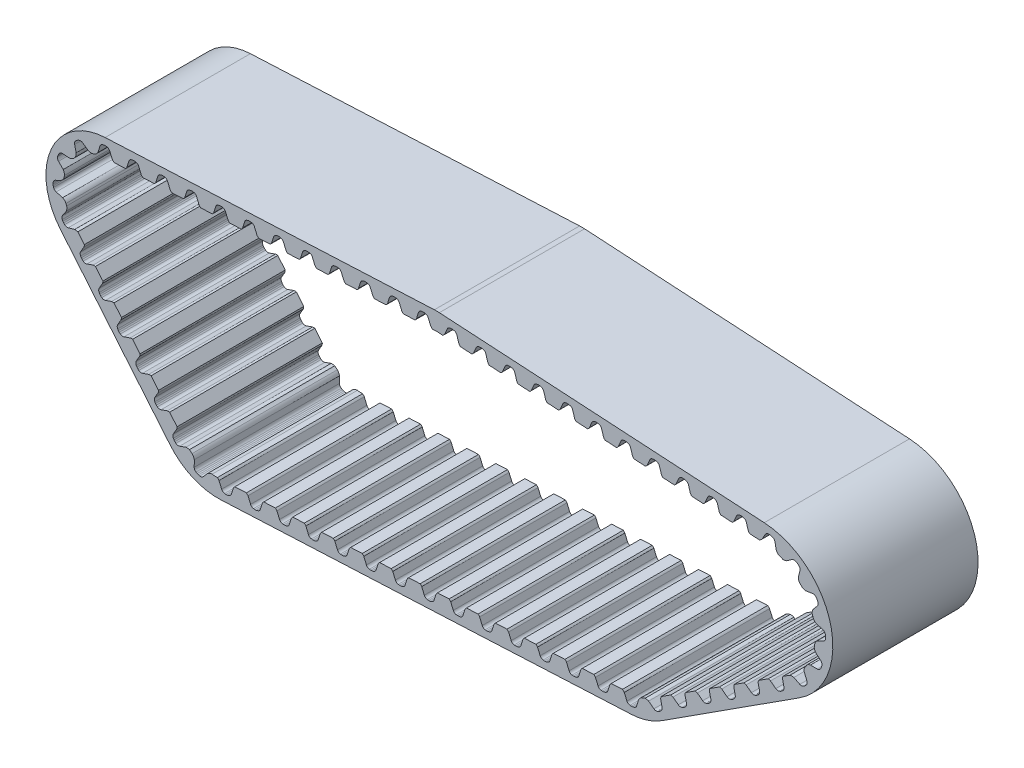
from build123d import *

# Parameters (mm, degrees)
EXTRUDE_THIN1_DEPTH = 23.5
CUT_EXTRUDE1_DEPTH  = 243.801978985
CRVPATTERN1_START   = -23.5
CRVPATTERN1_DEPTH   = 47


# Read off the part's stored shape, not the designer's step: CrvPattern1
with BuildPart() as part:
    # Sketch2 → Extrude-Thin1 (new, symmetric)
    with BuildSketch(Plane.XY):
        with BuildLine():
            Line((-103.735276554, 29.845488123), (1.408754191, 23.557916114))
            ThreePointArc((1.408754191, 23.557916114), (22.83034879, 5.977890442), (12.773230166, -19.844510352))
            Line((12.773230166, -19.844510352), (-31.718990744, -48.482625791))
            ThreePointArc((-31.718990744, -48.482625791), (-36.462798866, -50.721969822), (-41.624486842, -51.657573597))
            Line((-41.624486842, -51.657573597), (-90.638722177, -54.034014243))
            ThreePointArc((-90.638722177, -54.034014243), (-90.650882821, -54.034598934), (-90.663043932, -54.035173821))
            Line((-90.663043932, -54.035173821), (-174.494542463, -57.964139785))
            ThreePointArc((-174.494542463, -57.964139785), (-183.538750642, -56.28041853), (-190.885487118, -50.743444447))
            Line((-190.885487118, -50.743444447), (-226.394102859, -8.074490776))
            ThreePointArc((-226.394102859, -8.074490776), (-229.338468092, 12.885826392), (-211.885499661, 24.860719934))
            Line((-211.885499661, 24.860719934), (-105.343815721, 29.855846089))
            ThreePointArc((-105.343815721, 29.855846089), (-104.539408113, 29.872101623), (-103.735276554, 29.845488123))
        make_face()
        with BuildLine():
            Line((-104.075526506, 24.155652452), (1.068504238, 17.868080442))
            ThreePointArc((1.068504238, 17.868080442), (17.316239124, 4.53407792), (9.688170338, -15.051556581))
            Line((9.688170338, -15.051556581), (-34.804050573, -43.68967202))
            ThreePointArc((-34.804050573, -43.68967202), (-38.202599675, -45.293978191), (-41.900525389, -45.964261493))
            Line((-41.900525389, -45.964261493), (-90.914760724, -48.340702138))
            ThreePointArc((-90.914760724, -48.340702138), (-90.922329578, -48.341066054), (-90.929898724, -48.341423869))
            Line((-90.929898724, -48.341423869), (-174.761393835, -52.270389672))
            ThreePointArc((-174.761393835, -52.270389672), (-181.24082656, -51.064141609), (-186.504160155, -47.097354207))
            Line((-186.504160155, -47.097354207), (-222.012775896, -4.428400535))
            ThreePointArc((-222.012775896, -4.428400535), (-224.122171884, 10.587946093), (-211.618552709, 19.166974302))
            Line((-211.618552709, 19.166974302), (-105.07686877, 24.162100457))
            ThreePointArc((-105.07686877, 24.162100457), (-104.576111715, 24.172219796), (-104.075526506, 24.155652452))
        make_face(mode=Mode.SUBTRACT)
    extrude(amount=EXTRUDE_THIN1_DEPTH, both=True)

    # Sketch3 → Cut-Extrude1 (cut, symmetric)
    with BuildSketch(Plane.XY.offset(23.5)):
        with BuildLine():
            Line((18.586278327, -0.942730575), (20.554296532, -0.045322476))
            ThreePointArc((20.554296532, -0.045322476), (21.033515065, 0.349894471), (21.250922015, 0.931771653))
            Line((21.250922015, 0.931771653), (21.292969131, 1.369471611))
            Line((21.292969131, 1.369471611), (21.260450174, 1.805338008))
            Line((21.260450174, 1.805338008), (21.15391858, 2.231952861))
            ThreePointArc((21.15391858, 2.231952861), (20.852574204, 2.775127238), (20.32001513, 3.094857859))
            Line((20.32001513, 3.094857859), (18.240619062, 3.690297985))
            ThreePointArc((18.240619062, 3.690297985), (17.554412276, 4.223260232), (17.07945311, 4.950819372))
            ThreePointArc((17.07945311, 4.950819372), (15.419270028, 1.143906324), (17.62070002, -2.377812123))
            ThreePointArc((17.62070002, -2.377812123), (17.982060954, -1.578569752), (18.586278327, -0.942730575))
        make_face()
    extrude(amount=CUT_EXTRUDE1_DEPTH, both=True, mode=Mode.SUBTRACT)

    # CrvPattern1 outline → CrvPattern1 (cut)
    with BuildSketch(Plane.XY.offset(CRVPATTERN1_START)):
        with BuildLine():
            ThreePointArc((7.435006497, -20.499147469), (7.768448175, -19.975063998), (7.795175402, -19.354473559))
            Line((7.795175402, -19.354473559), (7.325772211, -17.243052806))
            ThreePointArc((7.325772211, -17.243052806), (7.351010391, -16.870815283), (7.428698337, -16.505901153))
            Line((7.428698337, -16.505901153), (2.704253067, -19.54686441))
            ThreePointArc((2.704253067, -19.54686441), (3.069519668, -19.627123594), (3.419698387, -19.758409887))
            Line((3.419698387, -19.758409887), (5.147711426, -21.059335668))
            ThreePointArc((5.147711426, -21.059335668), (5.72375147, -21.29176782), (6.338832857, -21.205039946))
            Line((6.338832857, -21.205039946), (6.743514797, -21.033046514))
            Line((6.743514797, -21.033046514), (7.110990693, -20.796406568))
            Line((7.110990693, -20.796406568), (7.435006497, -20.499147469))
        make_face()
        with BuildLine():
            ThreePointArc((-111.146172562, 24.442305878), (-111.354600443, 24.13286193), (-111.604741843, 23.856046072))
            Line((-111.604741843, 23.856046072), (-105.99238026, 24.119177394))
            ThreePointArc((-105.99238026, 24.119177394), (-106.268212238, 24.371720352), (-106.505410685, 24.660853752))
            Line((-106.505410685, 24.660853752), (-107.348542431, 26.652728701))
            ThreePointArc((-107.348542431, 26.652728701), (-107.730476539, 27.14259927), (-108.306176463, 27.375872573))
            Line((-108.306176463, 27.375872573), (-108.742559569, 27.429900326))
            Line((-108.742559569, 27.429900326), (-109.179153501, 27.409339763))
            Line((-109.179153501, 27.409339763), (-109.608527896, 27.314540804))
            ThreePointArc((-109.608527896, 27.314540804), (-110.159757434, 27.028196896), (-110.493964263, 26.504601029))
            Line((-110.493964263, 26.504601029), (-111.146172562, 24.442305878))
        make_face()
        with BuildLine():
            ThreePointArc((-120.516818461, 24.002970243), (-120.725246343, 23.693526294), (-120.975387743, 23.416710437))
            Line((-120.975387743, 23.416710437), (-115.36302616, 23.679841759))
            ThreePointArc((-115.36302616, 23.679841759), (-115.638858138, 23.932384717), (-115.876056585, 24.221518117))
            Line((-115.876056585, 24.221518117), (-116.71918833, 26.213393066))
            ThreePointArc((-116.71918833, 26.213393066), (-117.101122439, 26.703263634), (-117.676822363, 26.936536937))
            Line((-117.676822363, 26.936536937), (-118.113205469, 26.990564691))
            Line((-118.113205469, 26.990564691), (-118.549799401, 26.970004128))
            Line((-118.549799401, 26.970004128), (-118.979173795, 26.875205168))
            ThreePointArc((-118.979173795, 26.875205168), (-119.530403334, 26.588861261), (-119.864610163, 26.065265393))
            Line((-119.864610163, 26.065265393), (-120.516818461, 24.002970243))
        make_face()
        with BuildLine():
            ThreePointArc((-129.887464361, 23.563634607), (-130.095892242, 23.254190658), (-130.346033643, 22.977374801))
            Line((-130.346033643, 22.977374801), (-124.733672059, 23.240506123))
            ThreePointArc((-124.733672059, 23.240506123), (-125.009504038, 23.493049081), (-125.246702485, 23.782182481))
            Line((-125.246702485, 23.782182481), (-126.08983423, 25.77405743))
            ThreePointArc((-126.08983423, 25.77405743), (-126.471768338, 26.263927999), (-127.047468263, 26.497201302))
            Line((-127.047468263, 26.497201302), (-127.483851369, 26.551229055))
            Line((-127.483851369, 26.551229055), (-127.920445301, 26.530668492))
            Line((-127.920445301, 26.530668492), (-128.349819695, 26.435869533))
            ThreePointArc((-128.349819695, 26.435869533), (-128.901049233, 26.149525625), (-129.235256063, 25.625929758))
            Line((-129.235256063, 25.625929758), (-129.887464361, 23.563634607))
        make_face()
        with BuildLine():
            ThreePointArc((-139.258110261, 23.124298972), (-139.466538142, 22.814855023), (-139.716679543, 22.538039166))
            Line((-139.716679543, 22.538039166), (-134.104317959, 22.801170488))
            ThreePointArc((-134.104317959, 22.801170488), (-134.380149938, 23.053713446), (-134.617348385, 23.342846846))
            Line((-134.617348385, 23.342846846), (-135.46048013, 25.334721795))
            ThreePointArc((-135.46048013, 25.334721795), (-135.842414238, 25.824592363), (-136.418114163, 26.057865666))
            Line((-136.418114163, 26.057865666), (-136.854497269, 26.111893419))
            Line((-136.854497269, 26.111893419), (-137.291091201, 26.091332857))
            Line((-137.291091201, 26.091332857), (-137.720465595, 25.996533897))
            ThreePointArc((-137.720465595, 25.996533897), (-138.271695133, 25.71018999), (-138.605901963, 25.186594122))
            Line((-138.605901963, 25.186594122), (-139.258110261, 23.124298972))
        make_face()
        with BuildLine():
            ThreePointArc((-148.628756161, 22.684963336), (-148.837184042, 22.375519387), (-149.087325443, 22.09870353))
            Line((-149.087325443, 22.09870353), (-143.474963859, 22.361834852))
            ThreePointArc((-143.474963859, 22.361834852), (-143.750795837, 22.61437781), (-143.987994284, 22.90351121))
            Line((-143.987994284, 22.90351121), (-144.83112603, 24.895386159))
            ThreePointArc((-144.83112603, 24.895386159), (-145.213060138, 25.385256728), (-145.788760063, 25.618530031))
            Line((-145.788760063, 25.618530031), (-146.225143169, 25.672557784))
            Line((-146.225143169, 25.672557784), (-146.661737101, 25.651997221))
            Line((-146.661737101, 25.651997221), (-147.091111495, 25.557198262))
            ThreePointArc((-147.091111495, 25.557198262), (-147.642341033, 25.270854354), (-147.976547863, 24.747258487))
            Line((-147.976547863, 24.747258487), (-148.628756161, 22.684963336))
        make_face()
        with BuildLine():
            ThreePointArc((-157.999402061, 22.245627701), (-158.207829942, 21.936183752), (-158.457971342, 21.659367895))
            Line((-158.457971342, 21.659367895), (-152.845609759, 21.922499217))
            ThreePointArc((-152.845609759, 21.922499217), (-153.121441737, 22.175042175), (-153.358640184, 22.464175575))
            Line((-153.358640184, 22.464175575), (-154.20177193, 24.456050524))
            ThreePointArc((-154.20177193, 24.456050524), (-154.583706038, 24.945921092), (-155.159405963, 25.179194395))
            Line((-155.159405963, 25.179194395), (-155.595789068, 25.233222148))
            Line((-155.595789068, 25.233222148), (-156.032383001, 25.212661586))
            Line((-156.032383001, 25.212661586), (-156.461757395, 25.117862626))
            ThreePointArc((-156.461757395, 25.117862626), (-157.012986933, 24.831518719), (-157.347193762, 24.307922851))
            Line((-157.347193762, 24.307922851), (-157.999402061, 22.245627701))
        make_face()
        with BuildLine():
            ThreePointArc((-167.37004796, 21.806292065), (-167.578475842, 21.496848116), (-167.828617242, 21.220032259))
            Line((-167.828617242, 21.220032259), (-162.216255659, 21.483163581))
            ThreePointArc((-162.216255659, 21.483163581), (-162.492087637, 21.735706539), (-162.729286084, 22.024839939))
            Line((-162.729286084, 22.024839939), (-163.57241783, 24.016714888))
            ThreePointArc((-163.57241783, 24.016714888), (-163.954351938, 24.506585457), (-164.530051862, 24.73985876))
            Line((-164.530051862, 24.73985876), (-164.966434968, 24.793886513))
            Line((-164.966434968, 24.793886513), (-165.4030289, 24.77332595))
            Line((-165.4030289, 24.77332595), (-165.832403295, 24.67852699))
            ThreePointArc((-165.832403295, 24.67852699), (-166.383632833, 24.392183083), (-166.717839662, 23.868587216))
            Line((-166.717839662, 23.868587216), (-167.37004796, 21.806292065))
        make_face()
        with BuildLine():
            ThreePointArc((-176.74069386, 21.36695643), (-176.949121742, 21.057512481), (-177.199263142, 20.780696624))
            Line((-177.199263142, 20.780696624), (-171.586901558, 21.043827945))
            ThreePointArc((-171.586901558, 21.043827945), (-171.862733536, 21.296370903), (-172.099931984, 21.585504303))
            Line((-172.099931984, 21.585504303), (-172.943063729, 23.577379252))
            ThreePointArc((-172.943063729, 23.577379252), (-173.324997837, 24.067249821), (-173.900697762, 24.300523124))
            Line((-173.900697762, 24.300523124), (-174.337080868, 24.354550877))
            Line((-174.337080868, 24.354550877), (-174.7736748, 24.333990315))
            Line((-174.7736748, 24.333990315), (-175.203049194, 24.239191355))
            ThreePointArc((-175.203049194, 24.239191355), (-175.754278732, 23.952847448), (-176.088485562, 23.42925158))
            Line((-176.088485562, 23.42925158), (-176.74069386, 21.36695643))
        make_face()
        with BuildLine():
            ThreePointArc((-186.11133976, 20.927620794), (-186.319767641, 20.618176845), (-186.569909042, 20.341360988))
            Line((-186.569909042, 20.341360988), (-180.957547458, 20.60449231))
            ThreePointArc((-180.957547458, 20.60449231), (-181.233379437, 20.857035268), (-181.470577884, 21.146168668))
            Line((-181.470577884, 21.146168668), (-182.313709629, 23.138043617))
            ThreePointArc((-182.313709629, 23.138043617), (-182.695643737, 23.627914186), (-183.271343662, 23.861187489))
            Line((-183.271343662, 23.861187489), (-183.707726768, 23.915215242))
            Line((-183.707726768, 23.915215242), (-184.1443207, 23.894654679))
            Line((-184.1443207, 23.894654679), (-184.573695094, 23.799855719))
            ThreePointArc((-184.573695094, 23.799855719), (-185.124924632, 23.513511812), (-185.459131462, 22.989915945))
            Line((-185.459131462, 22.989915945), (-186.11133976, 20.927620794))
        make_face()
        with BuildLine():
            ThreePointArc((-195.48198566, 20.488285159), (-195.690413541, 20.17884121), (-195.940554942, 19.902025352))
            Line((-195.940554942, 19.902025352), (-190.328193358, 20.165156674))
            ThreePointArc((-190.328193358, 20.165156674), (-190.604025336, 20.417699633), (-190.841223784, 20.706833032))
            Line((-190.841223784, 20.706833032), (-191.684355529, 22.698707981))
            ThreePointArc((-191.684355529, 22.698707981), (-192.066289637, 23.18857855), (-192.641989562, 23.421851853))
            Line((-192.641989562, 23.421851853), (-193.078372668, 23.475879606))
            Line((-193.078372668, 23.475879606), (-193.5149666, 23.455319044))
            Line((-193.5149666, 23.455319044), (-193.944340994, 23.360520084))
            ThreePointArc((-193.944340994, 23.360520084), (-194.495570532, 23.074176176), (-194.829777362, 22.550580309))
            Line((-194.829777362, 22.550580309), (-195.48198566, 20.488285159))
        make_face()
        with BuildLine():
            ThreePointArc((-204.85263156, 20.048949523), (-205.061059441, 19.739505574), (-205.311200842, 19.462689717))
            Line((-205.311200842, 19.462689717), (-199.698839258, 19.725821039))
            ThreePointArc((-199.698839258, 19.725821039), (-199.974671236, 19.978363997), (-200.211869683, 20.267497397))
            Line((-200.211869683, 20.267497397), (-201.055001429, 22.259372346))
            ThreePointArc((-201.055001429, 22.259372346), (-201.436935537, 22.749242915), (-202.012635462, 22.982516218))
            Line((-202.012635462, 22.982516218), (-202.449018567, 23.036543971))
            Line((-202.449018567, 23.036543971), (-202.8856125, 23.015983408))
            Line((-202.8856125, 23.015983408), (-203.314986894, 22.921184448))
            ThreePointArc((-203.314986894, 22.921184448), (-203.866216432, 22.634840541), (-204.200423262, 22.111244674))
            Line((-204.200423262, 22.111244674), (-204.85263156, 20.048949523))
        make_face()
        with BuildLine():
            ThreePointArc((-214.183330625, 19.576262438), (-214.654011675, 18.96327482), (-215.282627075, 18.513678167))
            ThreePointArc((-215.282627075, 18.513678167), (-213.471785325, 18.959202861), (-211.618552709, 19.166974302))
            Line((-211.618552709, 19.166974302), (-208.976405214, 19.290849386))
            ThreePointArc((-208.976405214, 19.290849386), (-209.283343953, 19.554359297), (-209.54621141, 19.861848423))
            Line((-209.54621141, 19.861848423), (-210.418038539, 21.841331792))
            ThreePointArc((-210.418038539, 21.841331792), (-210.807011601, 22.325632106), (-211.386022311, 22.55056195))
            Line((-211.386022311, 22.55056195), (-211.823140577, 22.598278146))
            Line((-211.823140577, 22.598278146), (-212.259391814, 22.571410767))
            Line((-212.259391814, 22.571410767), (-212.687351492, 22.470417067))
            ThreePointArc((-212.687351492, 22.470417067), (-213.234385687, 22.176137563), (-213.560991444, 21.647766939))
            Line((-213.560991444, 21.647766939), (-214.183330625, 19.576262438))
        make_face()
        with BuildLine():
            ThreePointArc((-221.250961333, 15.878240308), (-221.34487559, 15.111119337), (-221.657839197, 14.404473562))
            ThreePointArc((-221.657839197, 14.404473562), (-219.011176926, 16.711028854), (-215.885029086, 18.308595182))
            ThreePointArc((-215.885029086, 18.308595182), (-216.656371241, 18.281929146), (-217.402205121, 18.48045275))
            Line((-217.402205121, 18.48045275), (-219.158922185, 19.742348986))
            ThreePointArc((-219.158922185, 19.742348986), (-219.740023628, 19.961820965), (-220.35300823, 19.861338552))
            Line((-220.35300823, 19.861338552), (-220.753736427, 19.680324394))
            Line((-220.753736427, 19.680324394), (-221.115819993, 19.435513263))
            Line((-221.115819993, 19.435513263), (-221.433096651, 19.131071585))
            ThreePointArc((-221.433096651, 19.131071585), (-221.754716514, 18.599651317), (-221.767537352, 17.978617934))
            Line((-221.767537352, 17.978617934), (-221.250961333, 15.878240308))
        make_face()
        with BuildLine():
            ThreePointArc((-225.459126195, 9.101949288), (-225.150218571, 8.393521062), (-225.06070337, 7.625874334))
            ThreePointArc((-225.06070337, 7.625874334), (-223.953200681, 10.957308902), (-222.072469492, 13.921742859))
            ThreePointArc((-222.072469492, 13.921742859), (-222.723263333, 13.506836635), (-223.466512118, 13.298843748))
            Line((-223.466512118, 13.298843748), (-225.620744568, 13.493058848))
            ThreePointArc((-225.620744568, 13.493058848), (-226.232756597, 13.386813314), (-226.709651794, 12.988795968))
            Line((-226.709651794, 12.988795968), (-226.962813953, 12.629271095))
            Line((-226.962813953, 12.629271095), (-227.150275244, 12.234435353))
            Line((-227.150275244, 12.234435353), (-227.268845277, 11.811008429))
            ThreePointArc((-227.268845277, 11.811008429), (-227.275822248, 11.189881905), (-226.971301219, 10.648482071))
            Line((-226.971301219, 10.648482071), (-225.459126195, 9.101949288))
        make_face()
        with BuildLine():
            ThreePointArc((-225.640333591, 1.127368711), (-225.014305828, 0.674175914), (-224.547146457, 0.058500194))
            ThreePointArc((-224.547146457, 0.058500194), (-225.286063201, 3.490557964), (-225.172529052, 6.999422237))
            ThreePointArc((-225.172529052, 6.999422237), (-225.522221681, 6.311385273), (-226.056682252, 5.754580373))
            Line((-226.056682252, 5.754580373), (-228.010770914, 4.827232298))
            ThreePointArc((-228.010770914, 4.827232298), (-228.483900059, 4.424745466), (-228.692398501, 3.839617073))
            Line((-228.692398501, 3.839617073), (-228.727758613, 3.401326216))
            Line((-228.727758613, 3.401326216), (-228.688589334, 2.966007061))
            Line((-228.688589334, 2.966007061), (-228.575557282, 2.54106828))
            ThreePointArc((-228.575557282, 2.54106828), (-228.265955705, 2.002557648), (-227.728577558, 1.690994548))
            Line((-227.728577558, 1.690994548), (-225.640333591, 1.127368711))
        make_face()
        with BuildLine():
            ThreePointArc((-221.744310273, -5.833074795), (-221.224772856, -5.856538472), (-220.72002507, -5.981835497))
            Line((-220.72002507, -5.981835497), (-222.012775896, -4.428400535))
            ThreePointArc((-222.012775896, -4.428400535), (-223.322761447, -2.574550545), (-224.325143184, -0.537873649))
            ThreePointArc((-224.325143184, -0.537873649), (-224.276717678, -1.308155915), (-224.45411204, -2.059295741))
            Line((-224.45411204, -2.059295741), (-225.665924606, -3.850928309))
            ThreePointArc((-225.665924606, -3.850928309), (-225.868908348, -4.437992562), (-225.7511653, -5.04789699))
            Line((-225.7511653, -5.04789699), (-225.558913238, -5.44335667))
            Line((-225.558913238, -5.44335667), (-225.303980311, -5.798386529))
            Line((-225.303980311, -5.798386529), (-224.990705206, -6.106944338))
            ThreePointArc((-224.990705206, -6.106944338), (-224.450419351, -6.413437457), (-223.829271516, -6.408725357))
            Line((-223.829271516, -6.408725357), (-221.744310273, -5.833074795))
        make_face()
        with BuildLine():
            ThreePointArc((-215.762622469, -12.820833045), (-215.390083379, -12.800526256), (-215.018422142, -12.83317076))
            Line((-215.018422142, -12.83317076), (-218.612396675, -8.514468676))
            ThreePointArc((-218.612396675, -8.514468676), (-218.647550308, -8.886793061), (-218.735189278, -9.250359612))
            Line((-218.735189278, -9.250359612), (-219.815864037, -11.124013533))
            ThreePointArc((-219.815864037, -11.124013533), (-219.976374126, -11.724082986), (-219.815345214, -12.324013421))
            Line((-219.815345214, -12.324013421), (-219.595323132, -12.704722623))
            Line((-219.595323132, -12.704722623), (-219.315669776, -13.040625882))
            Line((-219.315669776, -13.040625882), (-218.98114455, -13.32600648))
            ThreePointArc((-218.98114455, -13.32600648), (-218.420336573, -13.593104308), (-217.801113704, -13.544013824))
            Line((-217.801113704, -13.544013824), (-215.762622469, -12.820833045))
        make_face()
        with BuildLine():
            ThreePointArc((-209.761964419, -20.031528112), (-209.389425329, -20.011221323), (-209.017764092, -20.043865827))
            Line((-209.017764092, -20.043865827), (-212.611738624, -15.725163742))
            ThreePointArc((-212.611738624, -15.725163742), (-212.646892258, -16.097488128), (-212.734531227, -16.461054679))
            Line((-212.734531227, -16.461054679), (-213.815205987, -18.3347086))
            ThreePointArc((-213.815205987, -18.3347086), (-213.975716076, -18.934778053), (-213.814687164, -19.534708488))
            Line((-213.814687164, -19.534708488), (-213.594665082, -19.91541769))
            Line((-213.594665082, -19.91541769), (-213.315011726, -20.251320948))
            Line((-213.315011726, -20.251320948), (-212.9804865, -20.536701547))
            ThreePointArc((-212.9804865, -20.536701547), (-212.419678523, -20.803799375), (-211.800455654, -20.754708891))
            Line((-211.800455654, -20.754708891), (-209.761964419, -20.031528112))
        make_face()
        with BuildLine():
            ThreePointArc((-203.761306368, -27.242223179), (-203.388767278, -27.22191639), (-203.017106041, -27.254560893))
            Line((-203.017106041, -27.254560893), (-206.611080574, -22.935858809))
            ThreePointArc((-206.611080574, -22.935858809), (-206.646234207, -23.308183195), (-206.733873177, -23.671749746))
            Line((-206.733873177, -23.671749746), (-207.814547937, -25.545403667))
            ThreePointArc((-207.814547937, -25.545403667), (-207.975058026, -26.14547312), (-207.814029114, -26.745403554))
            Line((-207.814029114, -26.745403554), (-207.594007031, -27.126112756))
            Line((-207.594007031, -27.126112756), (-207.314353676, -27.462016015))
            Line((-207.314353676, -27.462016015), (-206.979828449, -27.747396614))
            ThreePointArc((-206.979828449, -27.747396614), (-206.419020472, -28.014494442), (-205.799797603, -27.965403957))
            Line((-205.799797603, -27.965403957), (-203.761306368, -27.242223179))
        make_face()
        with BuildLine():
            ThreePointArc((-197.760648318, -34.452918245), (-197.388109228, -34.432611456), (-197.016447991, -34.46525596))
            Line((-197.016447991, -34.46525596), (-200.610422523, -30.146553875))
            ThreePointArc((-200.610422523, -30.146553875), (-200.645576157, -30.518878261), (-200.733215126, -30.882444812))
            Line((-200.733215126, -30.882444812), (-201.813889886, -32.756098733))
            ThreePointArc((-201.813889886, -32.756098733), (-201.974399975, -33.356168186), (-201.813371063, -33.956098621))
            Line((-201.813371063, -33.956098621), (-201.593348981, -34.336807823))
            Line((-201.593348981, -34.336807823), (-201.313695625, -34.672711081))
            Line((-201.313695625, -34.672711081), (-200.979170399, -34.95809168))
            ThreePointArc((-200.979170399, -34.95809168), (-200.418362422, -35.225189508), (-199.799139553, -35.176099024))
            Line((-199.799139553, -35.176099024), (-197.760648318, -34.452918245))
        make_face()
        with BuildLine():
            ThreePointArc((-191.759990268, -41.663613312), (-191.387451178, -41.643306523), (-191.01578994, -41.675951027))
            Line((-191.01578994, -41.675951027), (-194.609764473, -37.357248942))
            ThreePointArc((-194.609764473, -37.357248942), (-194.644918107, -37.729573328), (-194.732557076, -38.093139879))
            Line((-194.732557076, -38.093139879), (-195.813231836, -39.9667938))
            ThreePointArc((-195.813231836, -39.9667938), (-195.973741925, -40.566863253), (-195.812713013, -41.166793688))
            Line((-195.812713013, -41.166793688), (-195.592690931, -41.547502889))
            Line((-195.592690931, -41.547502889), (-195.313037575, -41.883406148))
            Line((-195.313037575, -41.883406148), (-194.978512349, -42.168786747))
            ThreePointArc((-194.978512349, -42.168786747), (-194.417704371, -42.435884575), (-193.798481502, -42.38679409))
            Line((-193.798481502, -42.38679409), (-191.759990268, -41.663613312))
        make_face()
        with BuildLine():
            ThreePointArc((-185.759332217, -48.874308378), (-185.17883892, -48.865702728), (-184.610616529, -48.984739866))
            ThreePointArc((-184.610616529, -48.984739866), (-185.601284952, -48.085086868), (-186.504160155, -47.097354207))
            Line((-186.504160155, -47.097354207), (-188.609106423, -44.567944008))
            ThreePointArc((-188.609106423, -44.567944008), (-188.644260056, -44.940268394), (-188.731899026, -45.303834945))
            Line((-188.731899026, -45.303834945), (-189.812573786, -47.177488866))
            ThreePointArc((-189.812573786, -47.177488866), (-189.973083875, -47.777558319), (-189.812054963, -48.377488754))
            Line((-189.812054963, -48.377488754), (-189.59203288, -48.758197956))
            Line((-189.59203288, -48.758197956), (-189.312379525, -49.094101215))
            Line((-189.312379525, -49.094101215), (-188.977854298, -49.379481813))
            ThreePointArc((-188.977854298, -49.379481813), (-188.417046321, -49.646579641), (-187.797823452, -49.597489157))
            Line((-187.797823452, -49.597489157), (-185.759332217, -48.874308378))
        make_face()
        with BuildLine():
            ThreePointArc((-178.696022447, -52.674984916), (-178.011732717, -52.315760701), (-177.252546969, -52.171083574))
            ThreePointArc((-177.252546969, -52.171083574), (-180.655216273, -51.306872895), (-183.747639874, -49.64496593))
            ThreePointArc((-183.747639874, -49.64496593), (-183.28685245, -50.26412241), (-183.025767138, -50.990424178))
            Line((-183.025767138, -50.990424178), (-183.064021111, -53.15305535))
            ThreePointArc((-183.064021111, -53.15305535), (-182.913888257, -53.755804853), (-182.482494639, -54.202734807))
            Line((-182.482494639, -54.202734807), (-182.105638274, -54.429292732))
            Line((-182.105638274, -54.429292732), (-181.69830424, -54.58777296))
            Line((-181.69830424, -54.58777296), (-181.267424927, -54.675478324))
            ThreePointArc((-181.267424927, -54.675478324), (-180.647414273, -54.637615066), (-180.129400925, -54.294819195))
            Line((-180.129400925, -54.294819195), (-178.696022447, -52.674984916))
        make_face()
        with BuildLine():
            ThreePointArc((-170.390352876, -52.630289953), (-170.181919801, -52.320849503), (-169.931773753, -52.044037845))
            Line((-169.931773753, -52.044037845), (-174.761393835, -52.270389672))
            ThreePointArc((-174.761393835, -52.270389672), (-175.166436868, -52.283664093), (-175.571693043, -52.285535222))
            ThreePointArc((-175.571693043, -52.285535222), (-175.280378757, -52.546966197), (-175.031118421, -52.848759923))
            Line((-175.031118421, -52.848759923), (-174.188020112, -54.840649025))
            ThreePointArc((-174.188020112, -54.840649025), (-173.806094228, -55.330526006), (-173.230398219, -55.563808973))
            Line((-173.230398219, -55.563808973), (-172.79401602, -55.617844051))
            Line((-172.79401602, -55.617844051), (-172.357421743, -55.597290817))
            Line((-172.357421743, -55.597290817), (-171.928045757, -55.502499066))
            ThreePointArc((-171.928045757, -55.502499066), (-171.376811413, -55.216164411), (-171.042595794, -54.692574155))
            Line((-171.042595794, -54.692574155), (-170.390352876, -52.630289953))
        make_face()
        with BuildLine():
            ThreePointArc((-161.019699603, -52.19111162), (-160.811266527, -51.88167117), (-160.56112048, -51.604859512))
            Line((-160.56112048, -51.604859512), (-166.17348648, -51.86789662))
            ThreePointArc((-166.17348648, -51.86789662), (-165.897658741, -52.120444209), (-165.660465147, -52.40958159))
            Line((-165.660465147, -52.40958159), (-164.817366839, -54.401470693))
            ThreePointArc((-164.817366839, -54.401470693), (-164.435440954, -54.891347673), (-163.859744945, -55.12463064))
            Line((-163.859744945, -55.12463064), (-163.423362747, -55.178665718))
            Line((-163.423362747, -55.178665718), (-162.986768469, -55.158112485))
            Line((-162.986768469, -55.158112485), (-162.557392484, -55.063320733))
            ThreePointArc((-162.557392484, -55.063320733), (-162.006158139, -54.776986079), (-161.67194252, -54.253395822))
            Line((-161.67194252, -54.253395822), (-161.019699603, -52.19111162))
        make_face()
        with BuildLine():
            ThreePointArc((-151.649046329, -51.751933287), (-151.440613253, -51.442492837), (-151.190467206, -51.165681179))
            Line((-151.190467206, -51.165681179), (-156.802833206, -51.428718287))
            ThreePointArc((-156.802833206, -51.428718287), (-156.527005467, -51.681265876), (-156.289811874, -51.970403257))
            Line((-156.289811874, -51.970403257), (-155.446713565, -53.96229236))
            ThreePointArc((-155.446713565, -53.96229236), (-155.064787681, -54.45216934), (-154.489091672, -54.685452307))
            Line((-154.489091672, -54.685452307), (-154.052709473, -54.739487385))
            Line((-154.052709473, -54.739487385), (-153.616115196, -54.718934152))
            Line((-153.616115196, -54.718934152), (-153.18673921, -54.6241424))
            ThreePointArc((-153.18673921, -54.6241424), (-152.635504866, -54.337807746), (-152.301289247, -53.814217489))
            Line((-152.301289247, -53.814217489), (-151.649046329, -51.751933287))
        make_face()
        with BuildLine():
            ThreePointArc((-142.278393056, -51.312754954), (-142.06995998, -51.003314504), (-141.819813933, -50.726502846))
            Line((-141.819813933, -50.726502846), (-147.432179933, -50.989539954))
            ThreePointArc((-147.432179933, -50.989539954), (-147.156352194, -51.242087543), (-146.9191586, -51.531224924))
            Line((-146.9191586, -51.531224924), (-146.076060292, -53.523114027))
            ThreePointArc((-146.076060292, -53.523114027), (-145.694134407, -54.012991007), (-145.118438398, -54.246273974))
            Line((-145.118438398, -54.246273974), (-144.6820562, -54.300309052))
            Line((-144.6820562, -54.300309052), (-144.245461922, -54.279755819))
            Line((-144.245461922, -54.279755819), (-143.816085937, -54.184964067))
            ThreePointArc((-143.816085937, -54.184964067), (-143.264851592, -53.898629413), (-142.930635973, -53.375039156))
            Line((-142.930635973, -53.375039156), (-142.278393056, -51.312754954))
        make_face()
        with BuildLine():
            ThreePointArc((-132.907739782, -50.873576621), (-132.699306706, -50.564136171), (-132.449160659, -50.287324513))
            Line((-132.449160659, -50.287324513), (-138.061526659, -50.550361621))
            ThreePointArc((-138.061526659, -50.550361621), (-137.78569892, -50.80290921), (-137.548505327, -51.092046592))
            Line((-137.548505327, -51.092046592), (-136.705407018, -53.083935694))
            ThreePointArc((-136.705407018, -53.083935694), (-136.323481134, -53.573812674), (-135.747785125, -53.807095641))
            Line((-135.747785125, -53.807095641), (-135.311402926, -53.861130719))
            Line((-135.311402926, -53.861130719), (-134.874808649, -53.840577486))
            Line((-134.874808649, -53.840577486), (-134.445432663, -53.745785734))
            ThreePointArc((-134.445432663, -53.745785734), (-133.894198319, -53.45945108), (-133.5599827, -52.935860823))
            Line((-133.5599827, -52.935860823), (-132.907739782, -50.873576621))
        make_face()
        with BuildLine():
            ThreePointArc((-123.537086509, -50.434398288), (-123.328653433, -50.124957838), (-123.078507386, -49.84814618))
            Line((-123.078507386, -49.84814618), (-128.690873386, -50.111183289))
            ThreePointArc((-128.690873386, -50.111183289), (-128.415045647, -50.363730877), (-128.177852053, -50.652868259))
            Line((-128.177852053, -50.652868259), (-127.334753745, -52.644757361))
            ThreePointArc((-127.334753745, -52.644757361), (-126.95282786, -53.134634341), (-126.377131851, -53.367917308))
            Line((-126.377131851, -53.367917308), (-125.940749653, -53.421952386))
            Line((-125.940749653, -53.421952386), (-125.504155375, -53.401399153))
            Line((-125.504155375, -53.401399153), (-125.07477939, -53.306607401))
            ThreePointArc((-125.07477939, -53.306607401), (-124.523545045, -53.020272747), (-124.189329426, -52.49668249))
            Line((-124.189329426, -52.49668249), (-123.537086509, -50.434398288))
        make_face()
        with BuildLine():
            ThreePointArc((-114.166433235, -49.995219955), (-113.958000159, -49.685779505), (-113.707854112, -49.408967847))
            Line((-113.707854112, -49.408967847), (-119.320220112, -49.672004956))
            ThreePointArc((-119.320220112, -49.672004956), (-119.044392373, -49.924552544), (-118.80719878, -50.213689926))
            Line((-118.80719878, -50.213689926), (-117.964100471, -52.205579028))
            ThreePointArc((-117.964100471, -52.205579028), (-117.582174587, -52.695456008), (-117.006478578, -52.928738975))
            Line((-117.006478578, -52.928738975), (-116.570096379, -52.982774054))
            Line((-116.570096379, -52.982774054), (-116.133502102, -52.96222082))
            Line((-116.133502102, -52.96222082), (-115.704126116, -52.867429068))
            ThreePointArc((-115.704126116, -52.867429068), (-115.152891772, -52.581094414), (-114.818676153, -52.057504157))
            Line((-114.818676153, -52.057504157), (-114.166433235, -49.995219955))
        make_face()
        with BuildLine():
            ThreePointArc((-104.795779962, -49.556041622), (-104.587346886, -49.246601172), (-104.337200839, -48.969789514))
            Line((-104.337200839, -48.969789514), (-109.949566839, -49.232826623))
            ThreePointArc((-109.949566839, -49.232826623), (-109.6737391, -49.485374211), (-109.436545506, -49.774511593))
            Line((-109.436545506, -49.774511593), (-108.593447198, -51.766400695))
            ThreePointArc((-108.593447198, -51.766400695), (-108.211521313, -52.256277675), (-107.635825304, -52.489560642))
            Line((-107.635825304, -52.489560642), (-107.199443106, -52.543595721))
            Line((-107.199443106, -52.543595721), (-106.762848828, -52.523042487))
            Line((-106.762848828, -52.523042487), (-106.333472843, -52.428250735))
            ThreePointArc((-106.333472843, -52.428250735), (-105.782238498, -52.141916081), (-105.448022879, -51.618325824))
            Line((-105.448022879, -51.618325824), (-104.795779962, -49.556041622))
        make_face()
        with BuildLine():
            ThreePointArc((-95.425126688, -49.116863289), (-95.216693612, -48.807422839), (-94.966547565, -48.530611181))
            Line((-94.966547565, -48.530611181), (-100.578913565, -48.79364829))
            ThreePointArc((-100.578913565, -48.79364829), (-100.303085826, -49.046195878), (-100.065892233, -49.33533326))
            Line((-100.065892233, -49.33533326), (-99.222793924, -51.327222362))
            ThreePointArc((-99.222793924, -51.327222362), (-98.84086804, -51.817099342), (-98.265172031, -52.050382309))
            Line((-98.265172031, -52.050382309), (-97.828789832, -52.104417388))
            Line((-97.828789832, -52.104417388), (-97.392195555, -52.083864154))
            Line((-97.392195555, -52.083864154), (-96.962819569, -51.989072402))
            ThreePointArc((-96.962819569, -51.989072402), (-96.411585224, -51.702737748), (-96.077369605, -51.179147491))
            Line((-96.077369605, -51.179147491), (-95.425126688, -49.116863289))
        make_face()
        with BuildLine():
            ThreePointArc((-86.059094093, -48.670079721), (-85.851160607, -48.360303343), (-85.601461553, -48.083088406))
            Line((-85.601461553, -48.083088406), (-90.914760718, -48.340702138))
            ThreePointArc((-90.914760718, -48.340702138), (-90.922335962, -48.341066359), (-90.929911498, -48.341424467))
            Line((-90.929911498, -48.341424467), (-91.213958509, -48.354737017))
            ThreePointArc((-91.213958509, -48.354737017), (-90.937407866, -48.607023676), (-90.69950107, -48.896037817))
            Line((-90.69950107, -48.896037817), (-89.853189716, -50.88656389))
            ThreePointArc((-89.853189716, -50.88656389), (-89.470473856, -51.375823951), (-88.894402168, -51.608177663))
            Line((-88.894402168, -51.608177663), (-88.457933345, -51.661508518))
            Line((-88.457933345, -51.661508518), (-88.021372801, -51.640250816))
            Line((-88.021372801, -51.640250816), (-87.592150332, -51.544766339))
            ThreePointArc((-87.592150332, -51.544766339), (-87.041378739, -51.257542578), (-86.708008428, -50.733413707))
            Line((-86.708008428, -50.733413707), (-86.059094093, -48.670079721))
        make_face()
        with BuildLine():
            ThreePointArc((-76.689161684, -48.215781331), (-76.481228198, -47.906004953), (-76.231529144, -47.628790015))
            Line((-76.231529144, -47.628790015), (-81.843463396, -47.900882981))
            ThreePointArc((-81.843463396, -47.900882981), (-81.567228502, -48.152985161), (-81.32956866, -48.441739427))
            Line((-81.32956866, -48.441739427), (-80.483257307, -50.4322655))
            ThreePointArc((-80.483257307, -50.4322655), (-80.100541446, -50.921525561), (-79.524469758, -51.153879272))
            Line((-79.524469758, -51.153879272), (-79.088000936, -51.207210127))
            Line((-79.088000936, -51.207210127), (-78.651440392, -51.185952425))
            Line((-78.651440392, -51.185952425), (-78.222217923, -51.090467949))
            ThreePointArc((-78.222217923, -51.090467949), (-77.67144633, -50.803244187), (-77.338076019, -50.279115317))
            Line((-77.338076019, -50.279115317), (-76.689161684, -48.215781331))
        make_face()
        with BuildLine():
            ThreePointArc((-67.319229275, -47.76148294), (-67.111295788, -47.451706562), (-66.861596734, -47.174491625))
            Line((-66.861596734, -47.174491625), (-72.473530987, -47.446584591))
            ThreePointArc((-72.473530987, -47.446584591), (-72.197296092, -47.698686771), (-71.959636251, -47.987441036))
            Line((-71.959636251, -47.987441036), (-71.113324898, -49.977967109))
            ThreePointArc((-71.113324898, -49.977967109), (-70.730609037, -50.46722717), (-70.154537349, -50.699580882))
            Line((-70.154537349, -50.699580882), (-69.718068527, -50.752911737))
            Line((-69.718068527, -50.752911737), (-69.281507983, -50.731654035))
            Line((-69.281507983, -50.731654035), (-68.852285514, -50.636169558))
            ThreePointArc((-68.852285514, -50.636169558), (-68.301513921, -50.348945797), (-67.96814361, -49.824816926))
            Line((-67.96814361, -49.824816926), (-67.319229275, -47.76148294))
        make_face()
        with BuildLine():
            ThreePointArc((-57.949296866, -47.30718455), (-57.741363379, -46.997408172), (-57.491664325, -46.720193234))
            Line((-57.491664325, -46.720193234), (-63.103598578, -46.9922862))
            ThreePointArc((-63.103598578, -46.9922862), (-62.827363683, -47.24438838), (-62.589703842, -47.533142646))
            Line((-62.589703842, -47.533142646), (-61.743392489, -49.523668719))
            ThreePointArc((-61.743392489, -49.523668719), (-61.360676628, -50.01292878), (-60.78460494, -50.245282491))
            Line((-60.78460494, -50.245282491), (-60.348136118, -50.298613346))
            Line((-60.348136118, -50.298613346), (-59.911575574, -50.277355644))
            Line((-59.911575574, -50.277355644), (-59.482353105, -50.181871168))
            ThreePointArc((-59.482353105, -50.181871168), (-58.931581512, -49.894647407), (-58.598211201, -49.370518536))
            Line((-58.598211201, -49.370518536), (-57.949296866, -47.30718455))
        make_face()
        with BuildLine():
            ThreePointArc((-48.579364457, -46.852886159), (-48.37143097, -46.543109781), (-48.121731916, -46.265894844))
            Line((-48.121731916, -46.265894844), (-53.733666169, -46.53798781))
            ThreePointArc((-53.733666169, -46.53798781), (-53.457431274, -46.79008999), (-53.219771433, -47.078844256))
            Line((-53.219771433, -47.078844256), (-52.373460079, -49.069370328))
            ThreePointArc((-52.373460079, -49.069370328), (-51.990744219, -49.558630389), (-51.414672531, -49.790984101))
            Line((-51.414672531, -49.790984101), (-50.978203708, -49.844314956))
            Line((-50.978203708, -49.844314956), (-50.541643164, -49.823057254))
            Line((-50.541643164, -49.823057254), (-50.112420695, -49.727572778))
            ThreePointArc((-50.112420695, -49.727572778), (-49.561649102, -49.440349016), (-49.228278791, -48.916220145))
            Line((-49.228278791, -48.916220145), (-48.579364457, -46.852886159))
        make_face()
        with BuildLine():
            ThreePointArc((-39.263072062, -46.353378333), (-38.796366793, -45.737358315), (-38.170673366, -45.283704033))
            ThreePointArc((-38.170673366, -45.283704033), (-40.013103156, -45.747275187), (-41.900525389, -45.964261493))
            Line((-41.900525389, -45.964261493), (-44.488370276, -46.089732384))
            ThreePointArc((-44.488370276, -46.089732384), (-44.170387928, -46.355994412), (-43.898246529, -46.668959744))
            Line((-43.898246529, -46.668959744), (-43.013630713, -48.642761104))
            ThreePointArc((-43.013630713, -48.642761104), (-42.621532448, -49.12453469), (-42.041078597, -49.345713722))
            Line((-42.041078597, -49.345713722), (-41.603660765, -49.390600835))
            Line((-41.603660765, -49.390600835), (-41.167592485, -49.360911544))
            Line((-41.167592485, -49.360911544), (-40.740295177, -49.257151129))
            ThreePointArc((-40.740295177, -49.257151129), (-40.195176372, -48.959338562), (-39.871995922, -48.42886591))
            Line((-39.871995922, -48.42886591), (-39.263072062, -46.353378333))
        make_face()
        with BuildLine():
            ThreePointArc((-32.114936514, -42.62968324), (-32.089698334, -42.257445718), (-32.012010388, -41.892531588))
            Line((-32.012010388, -41.892531588), (-34.804050573, -43.68967202))
            ThreePointArc((-34.804050573, -43.68967202), (-35.943220307, -44.351256111), (-37.13808311, -44.905966915))
            ThreePointArc((-37.13808311, -44.905966915), (-36.566401367, -44.964081811), (-36.021010338, -45.145040321))
            Line((-36.021010338, -45.145040321), (-34.292997298, -46.445966102))
            ThreePointArc((-34.292997298, -46.445966102), (-33.716957254, -46.678398254), (-33.101875867, -46.591670381))
            Line((-33.101875867, -46.591670381), (-32.697193928, -46.419676948))
            Line((-32.697193928, -46.419676948), (-32.329718031, -46.183037002))
            Line((-32.329718031, -46.183037002), (-32.005702227, -45.885777903))
            ThreePointArc((-32.005702227, -45.885777903), (-31.67226055, -45.361694432), (-31.645533323, -44.741103993))
            Line((-31.645533323, -44.741103993), (-32.114936514, -42.62968324))
        make_face()
        with BuildLine():
            ThreePointArc((-24.226794769, -37.552357153), (-24.201556589, -37.180119631), (-24.123868643, -36.815205501))
            Line((-24.123868643, -36.815205501), (-28.848313913, -39.856168758))
            ThreePointArc((-28.848313913, -39.856168758), (-28.483047312, -39.936427941), (-28.132868593, -40.067714234))
            Line((-28.132868593, -40.067714234), (-26.404855553, -41.368640016))
            ThreePointArc((-26.404855553, -41.368640016), (-25.828815509, -41.601072167), (-25.213734122, -41.514344294))
            Line((-25.213734122, -41.514344294), (-24.809052183, -41.342350861))
            Line((-24.809052183, -41.342350861), (-24.441576286, -41.105710915))
            Line((-24.441576286, -41.105710915), (-24.117560482, -40.808451817))
            ThreePointArc((-24.117560482, -40.808451817), (-23.784118805, -40.284368345), (-23.757391578, -39.663777907))
            Line((-23.757391578, -39.663777907), (-24.226794769, -37.552357153))
        make_face()
        with BuildLine():
            ThreePointArc((-16.338653024, -32.475031066), (-16.313414844, -32.102793544), (-16.235726898, -31.737879414))
            Line((-16.235726898, -31.737879414), (-20.960172168, -34.778842671))
            ThreePointArc((-20.960172168, -34.778842671), (-20.594905567, -34.859101854), (-20.244726848, -34.990388148))
            Line((-20.244726848, -34.990388148), (-18.516713809, -36.291313929))
            ThreePointArc((-18.516713809, -36.291313929), (-17.940673765, -36.523746081), (-17.325592378, -36.437018207))
            Line((-17.325592378, -36.437018207), (-16.920910438, -36.265024774))
            Line((-16.920910438, -36.265024774), (-16.553434542, -36.028384828))
            Line((-16.553434542, -36.028384828), (-16.229418737, -35.73112573))
            ThreePointArc((-16.229418737, -35.73112573), (-15.89597706, -35.207042258), (-15.869249833, -34.58645182))
            Line((-15.869249833, -34.58645182), (-16.338653024, -32.475031066))
        make_face()
        with BuildLine():
            ThreePointArc((-8.450511279, -27.39770498), (-8.425273099, -27.025467457), (-8.347585153, -26.660553327))
            Line((-8.347585153, -26.660553327), (-13.072030423, -29.701516584))
            ThreePointArc((-13.072030423, -29.701516584), (-12.706763822, -29.781775767), (-12.356585103, -29.913062061))
            Line((-12.356585103, -29.913062061), (-10.628572064, -31.213987842))
            ThreePointArc((-10.628572064, -31.213987842), (-10.05253202, -31.446419994), (-9.437450633, -31.35969212))
            Line((-9.437450633, -31.35969212), (-9.032768693, -31.187698687))
            Line((-9.032768693, -31.187698687), (-8.665292797, -30.951058742))
            Line((-8.665292797, -30.951058742), (-8.341276992, -30.653799643))
            ThreePointArc((-8.341276992, -30.653799643), (-8.007835315, -30.129716171), (-7.981108088, -29.509125733))
            Line((-7.981108088, -29.509125733), (-8.450511279, -27.39770498))
        make_face()
        with BuildLine():
            ThreePointArc((-0.562369534, -22.320378893), (-0.537131354, -21.94814137), (-0.459443408, -21.58322724))
            Line((-0.459443408, -21.58322724), (-5.183888678, -24.624190497))
            ThreePointArc((-5.183888678, -24.624190497), (-4.818622077, -24.704449681), (-4.468443358, -24.835735974))
            Line((-4.468443358, -24.835735974), (-2.740430319, -26.136661755))
            ThreePointArc((-2.740430319, -26.136661755), (-2.164390275, -26.369093907), (-1.549308888, -26.282366033))
            Line((-1.549308888, -26.282366033), (-1.144626948, -26.110372601))
            Line((-1.144626948, -26.110372601), (-0.777151052, -25.873732655))
            Line((-0.777151052, -25.873732655), (-0.453135247, -25.576473556))
            ThreePointArc((-0.453135247, -25.576473556), (-0.11969357, -25.052390085), (-0.092966343, -24.431799646))
            Line((-0.092966343, -24.431799646), (-0.562369534, -22.320378893))
        make_face()
        with BuildLine():
            ThreePointArc((17.579420987, -3.372529876), (16.687852718, -6.47499588), (15.253571725, -9.366885802))
            ThreePointArc((15.253571725, -9.366885802), (15.782644357, -9.039091828), (16.373957181, -8.84488605))
            Line((16.373957181, -8.84488605), (18.536622681, -8.88114743))
            ThreePointArc((18.536622681, -8.88114743), (19.1392336, -8.730459285), (19.585765893, -8.298654064))
            Line((19.585765893, -8.298654064), (19.811976498, -7.921589117))
            Line((19.811976498, -7.921589117), (19.970081354, -7.514109236))
            Line((19.970081354, -7.514109236), (20.057389683, -7.083149297))
            ThreePointArc((20.057389683, -7.083149297), (20.018955184, -6.463173792), (19.675682178, -5.945476506))
            Line((19.675682178, -5.945476506), (18.054527919, -4.513591098))
            ThreePointArc((18.054527919, -4.513591098), (17.748947726, -3.97138497), (17.579420987, -3.372529876))
        make_face()
        with BuildLine():
            ThreePointArc((14.419944887, -10.605432073), (12.280705544, -13.022836533), (9.742080175, -15.01671981))
            ThreePointArc((9.742080175, -15.01671981), (10.360700583, -14.948341962), (10.978055352, -15.02733455))
            Line((10.978055352, -15.02733455), (12.914882125, -15.990215126))
            ThreePointArc((12.914882125, -15.990215126), (13.523720078, -16.113354008), (14.112558653, -15.915576432))
            Line((14.112558653, -15.915576432), (14.478950728, -15.672459052))
            Line((14.478950728, -15.672459052), (14.796939145, -15.372591806))
            Line((14.796939145, -15.372591806), (15.06111208, -15.021078117))
            ThreePointArc((15.06111208, -15.021078117), (15.293060259, -14.444843026), (15.205815728, -13.82983471))
            Line((15.205815728, -13.82983471), (14.358103527, -11.839904818))
            ThreePointArc((14.358103527, -11.839904818), (14.315428559, -11.218981645), (14.419944887, -10.605432073))
        make_face()
        with BuildLine():
            ThreePointArc((-100.222408548, 27.29245356), (-100.800970689, 27.066372411), (-101.188979626, 26.581299322))
            Line((-101.188979626, 26.581299322), (-102.056867504, 24.600085657))
            ThreePointArc((-102.056867504, 24.600085657), (-102.297030389, 24.314569409), (-102.575199235, 24.065933466))
            Line((-102.575199235, 24.065933466), (-96.966691725, 23.730546906))
            ThreePointArc((-96.966691725, 23.730546906), (-97.214093901, 24.010999021), (-97.419189385, 24.32372425))
            Line((-97.419189385, 24.32372425), (-98.045647906, 26.393986715))
            ThreePointArc((-98.045647906, 26.393986715), (-98.373304036, 26.92170662), (-98.92092252, 27.214897399))
            Line((-98.92092252, 27.214897399), (-99.349082244, 27.315039614))
            Line((-99.349082244, 27.315039614), (-99.785386063, 27.341039163))
            Line((-99.785386063, 27.341039163), (-100.222408548, 27.29245356))
        make_face()
        with BuildLine():
            ThreePointArc((14.880195344, 11.176684192), (14.266610873, 11.280995442), (13.694754479, 11.526651715))
            ThreePointArc((13.694754479, 11.526651715), (15.542282035, 8.87960974), (16.884352456, 5.943790217))
            ThreePointArc((16.884352456, 5.943790217), (16.963138697, 6.561171353), (17.184878246, 7.142719555))
            Line((17.184878246, 7.142719555), (18.575608316, 8.799314504))
            ThreePointArc((18.575608316, 8.799314504), (18.838260231, 9.362218412), (18.784271508, 9.981033453))
            Line((18.784271508, 9.981033453), (18.633979935, 10.394266626))
            Line((18.633979935, 10.394266626), (18.417159809, 10.773774244))
            Line((18.417159809, 10.773774244), (18.137501181, 11.113097489))
            ThreePointArc((18.137501181, 11.113097489), (17.631837171, 11.473861603), (17.013537236, 11.533460487))
            Line((17.013537236, 11.533460487), (14.880195344, 11.176684192))
        make_face()
        with BuildLine():
            ThreePointArc((8.626622344, 16.489993024), (8.027823945, 16.320266134), (7.405905727, 16.29609034))
            ThreePointArc((7.405905727, 16.29609034), (10.212296939, 14.700986063), (12.686569718, 12.627784794))
            ThreePointArc((12.686569718, 12.627784794), (12.492166311, 13.219032673), (12.442230487, 13.839414131))
            Line((12.442230487, 13.839414131), (12.985273438, 15.933104964))
            ThreePointArc((12.985273438, 15.933104964), (12.980291449, 16.554250694), (12.665404055, 17.08968768))
            Line((12.665404055, 17.08968768), (12.35199491, 17.398109341))
            Line((12.35199491, 17.398109341), (11.993029851, 17.647470694))
            Line((11.993029851, 17.647470694), (11.59461808, 17.833527875))
            ThreePointArc((11.59461808, 17.833527875), (10.982950449, 17.941738532), (10.399125414, 17.729617895))
            Line((10.399125414, 17.729617895), (8.626622344, 16.489993024))
        make_face()
        with BuildLine():
            ThreePointArc((0.695779278, 18.59716038), (0.279209237, 18.222357126), (-0.207344356, 17.94437569))
            Line((-0.207344356, 17.94437569), (1.068504238, 17.868080442))
            ThreePointArc((1.068504238, 17.868080442), (3.58121646, 17.538098205), (6.022143282, 16.856565198))
            ThreePointArc((6.022143282, 16.856565198), (5.59234799, 17.306723778), (5.280445791, 17.84531802))
            Line((5.280445791, 17.84531802), (4.870218041, 19.969029428))
            ThreePointArc((4.870218041, 19.969029428), (4.598570793, 20.527647912), (4.084008134, 20.875602086))
            Line((4.084008134, 20.875602086), (3.668417409, 21.019245957))
            Line((3.668417409, 21.019245957), (3.23710082, 21.089977837))
            Line((3.23710082, 21.089977837), (2.797398919, 21.086593944))
            ThreePointArc((2.797398919, 21.086593944), (2.198653912, 20.921211798), (1.762816599, 20.478614155))
            Line((1.762816599, 20.478614155), (0.695779278, 18.59716038))
        make_face()
        with BuildLine():
            ThreePointArc((-8.414757811, 19.000324039), (-8.654920695, 18.71480779), (-8.933089541, 18.466171848))
            Line((-8.933089541, 18.466171848), (-3.324582031, 18.130785287))
            ThreePointArc((-3.324582031, 18.130785287), (-3.571984208, 18.411237402), (-3.777079691, 18.723962631))
            Line((-3.777079691, 18.723962631), (-4.403538213, 20.794225096))
            ThreePointArc((-4.403538213, 20.794225096), (-4.731194342, 21.321945001), (-5.278812826, 21.61513578))
            Line((-5.278812826, 21.61513578), (-5.706972551, 21.715277996))
            Line((-5.706972551, 21.715277996), (-6.143276369, 21.741277544))
            Line((-6.143276369, 21.741277544), (-6.580298854, 21.692691941))
            ThreePointArc((-6.580298854, 21.692691941), (-7.158860995, 21.466610792), (-7.546869932, 20.981537703))
            Line((-7.546869932, 20.981537703), (-8.414757811, 19.000324039))
        make_face()
        with BuildLine():
            ThreePointArc((-17.77896878, 19.560300201), (-18.019131665, 19.274783952), (-18.297300511, 19.026148009))
            Line((-18.297300511, 19.026148009), (-12.688793, 18.690761449))
            ThreePointArc((-12.688793, 18.690761449), (-12.936195177, 18.971213564), (-13.141290661, 19.283938793))
            Line((-13.141290661, 19.283938793), (-13.767749182, 21.354201258))
            ThreePointArc((-13.767749182, 21.354201258), (-14.095405311, 21.881921163), (-14.643023795, 22.175111942))
            Line((-14.643023795, 22.175111942), (-15.07118352, 22.275254157))
            Line((-15.07118352, 22.275254157), (-15.507487338, 22.301253706))
            Line((-15.507487338, 22.301253706), (-15.944509823, 22.252668103))
            ThreePointArc((-15.944509823, 22.252668103), (-16.523071964, 22.026586954), (-16.911080902, 21.541513865))
            Line((-16.911080902, 21.541513865), (-17.77896878, 19.560300201))
        make_face()
        with BuildLine():
            ThreePointArc((-27.143179749, 20.120276362), (-27.383342634, 19.834760114), (-27.66151148, 19.586124171))
            Line((-27.66151148, 19.586124171), (-22.05300397, 19.250737611))
            ThreePointArc((-22.05300397, 19.250737611), (-22.300406146, 19.531189726), (-22.50550163, 19.843914955))
            Line((-22.50550163, 19.843914955), (-23.131960151, 21.91417742))
            ThreePointArc((-23.131960151, 21.91417742), (-23.459616281, 22.441897325), (-24.007234765, 22.735088104))
            Line((-24.007234765, 22.735088104), (-24.435394489, 22.835230319))
            Line((-24.435394489, 22.835230319), (-24.871698308, 22.861229868))
            Line((-24.871698308, 22.861229868), (-25.308720793, 22.812644265))
            ThreePointArc((-25.308720793, 22.812644265), (-25.887282934, 22.586563116), (-26.275291871, 22.101490027))
            Line((-26.275291871, 22.101490027), (-27.143179749, 20.120276362))
        make_face()
        with BuildLine():
            ThreePointArc((-36.507390719, 20.680252524), (-36.747553603, 20.394736276), (-37.025722449, 20.146100333))
            Line((-37.025722449, 20.146100333), (-31.417214939, 19.810713773))
            ThreePointArc((-31.417214939, 19.810713773), (-31.664617116, 20.091165888), (-31.869712599, 20.403891117))
            Line((-31.869712599, 20.403891117), (-32.496171121, 22.474153582))
            ThreePointArc((-32.496171121, 22.474153582), (-32.82382725, 23.001873487), (-33.371445734, 23.295064266))
            Line((-33.371445734, 23.295064266), (-33.799605459, 23.395206481))
            Line((-33.799605459, 23.395206481), (-34.235909277, 23.42120603))
            Line((-34.235909277, 23.42120603), (-34.672931762, 23.372620427))
            ThreePointArc((-34.672931762, 23.372620427), (-35.251493903, 23.146539278), (-35.63950284, 22.661466189))
            Line((-35.63950284, 22.661466189), (-36.507390719, 20.680252524))
        make_face()
        with BuildLine():
            ThreePointArc((-45.871601688, 21.240228686), (-46.111764573, 20.954712438), (-46.389933419, 20.706076495))
            Line((-46.389933419, 20.706076495), (-40.781425908, 20.370689934))
            ThreePointArc((-40.781425908, 20.370689934), (-41.028828085, 20.65114205), (-41.233923569, 20.963867279))
            Line((-41.233923569, 20.963867279), (-41.86038209, 23.034129744))
            ThreePointArc((-41.86038209, 23.034129744), (-42.188038219, 23.561849649), (-42.735656704, 23.855040428))
            Line((-42.735656704, 23.855040428), (-43.163816428, 23.955182643))
            Line((-43.163816428, 23.955182643), (-43.600120247, 23.981182192))
            Line((-43.600120247, 23.981182192), (-44.037142731, 23.932596588))
            ThreePointArc((-44.037142731, 23.932596588), (-44.615704873, 23.706515439), (-45.00371381, 23.22144235))
            Line((-45.00371381, 23.22144235), (-45.871601688, 21.240228686))
        make_face()
        with BuildLine():
            ThreePointArc((-55.235812657, 21.800204848), (-55.475975542, 21.5146886), (-55.754144388, 21.266052657))
            Line((-55.754144388, 21.266052657), (-50.145636878, 20.930666096))
            ThreePointArc((-50.145636878, 20.930666096), (-50.393039055, 21.211118212), (-50.598134538, 21.523843441))
            Line((-50.598134538, 21.523843441), (-51.224593059, 23.594105906))
            ThreePointArc((-51.224593059, 23.594105906), (-51.552249189, 24.12182581), (-52.099867673, 24.415016589))
            Line((-52.099867673, 24.415016589), (-52.528027398, 24.515158805))
            Line((-52.528027398, 24.515158805), (-52.964331216, 24.541158353))
            Line((-52.964331216, 24.541158353), (-53.401353701, 24.49257275))
            ThreePointArc((-53.401353701, 24.49257275), (-53.979915842, 24.266491601), (-54.367924779, 23.781418512))
            Line((-54.367924779, 23.781418512), (-55.235812657, 21.800204848))
        make_face()
        with BuildLine():
            ThreePointArc((-64.600023627, 22.36018101), (-64.840186511, 22.074664762), (-65.118355357, 21.826028819))
            Line((-65.118355357, 21.826028819), (-59.509847847, 21.490642258))
            ThreePointArc((-59.509847847, 21.490642258), (-59.757250024, 21.771094373), (-59.962345507, 22.083819602))
            Line((-59.962345507, 22.083819602), (-60.588804029, 24.154082067))
            ThreePointArc((-60.588804029, 24.154082067), (-60.916460158, 24.681801972), (-61.464078642, 24.974992751))
            Line((-61.464078642, 24.974992751), (-61.892238367, 25.075134967))
            Line((-61.892238367, 25.075134967), (-62.328542185, 25.101134515))
            Line((-62.328542185, 25.101134515), (-62.76556467, 25.052548912))
            ThreePointArc((-62.76556467, 25.052548912), (-63.344126811, 24.826467763), (-63.732135749, 24.341394674))
            Line((-63.732135749, 24.341394674), (-64.600023627, 22.36018101))
        make_face()
        with BuildLine():
            ThreePointArc((-73.964234596, 22.920157172), (-74.204397481, 22.634640924), (-74.482566327, 22.386004981))
            Line((-74.482566327, 22.386004981), (-68.874058817, 22.05061842))
            ThreePointArc((-68.874058817, 22.05061842), (-69.121460993, 22.331070535), (-69.326556477, 22.643795764))
            Line((-69.326556477, 22.643795764), (-69.953014998, 24.714058229))
            ThreePointArc((-69.953014998, 24.714058229), (-70.280671128, 25.241778134), (-70.828289612, 25.534968913))
            Line((-70.828289612, 25.534968913), (-71.256449336, 25.635111129))
            Line((-71.256449336, 25.635111129), (-71.692753155, 25.661110677))
            Line((-71.692753155, 25.661110677), (-72.129775639, 25.612525074))
            ThreePointArc((-72.129775639, 25.612525074), (-72.708337781, 25.386443925), (-73.096346718, 24.901370836))
            Line((-73.096346718, 24.901370836), (-73.964234596, 22.920157172))
        make_face()
        with BuildLine():
            ThreePointArc((-83.328445566, 23.480133334), (-83.56860845, 23.194617085), (-83.846777296, 22.945981142))
            Line((-83.846777296, 22.945981142), (-78.238269786, 22.610594582))
            ThreePointArc((-78.238269786, 22.610594582), (-78.485671963, 22.891046697), (-78.690767446, 23.203771926))
            Line((-78.690767446, 23.203771926), (-79.317225968, 25.274034391))
            ThreePointArc((-79.317225968, 25.274034391), (-79.644882097, 25.801754296), (-80.192500581, 26.094945075))
            Line((-80.192500581, 26.094945075), (-80.620660306, 26.19508729))
            Line((-80.620660306, 26.19508729), (-81.056964124, 26.221086839))
            Line((-81.056964124, 26.221086839), (-81.493986609, 26.172501236))
            ThreePointArc((-81.493986609, 26.172501236), (-82.07254875, 25.946420087), (-82.460557687, 25.461346998))
            Line((-82.460557687, 25.461346998), (-83.328445566, 23.480133334))
        make_face()
        with BuildLine():
            ThreePointArc((-92.692656535, 24.040109495), (-92.932819419, 23.754593247), (-93.210988266, 23.505957304))
            Line((-93.210988266, 23.505957304), (-87.602480755, 23.170570744))
            ThreePointArc((-87.602480755, 23.170570744), (-87.849882932, 23.451022859), (-88.054978415, 23.763748088))
            Line((-88.054978415, 23.763748088), (-88.681436937, 25.834010553))
            ThreePointArc((-88.681436937, 25.834010553), (-89.009093066, 26.361730458), (-89.55671155, 26.654921237))
            Line((-89.55671155, 26.654921237), (-89.984871275, 26.755063452))
            Line((-89.984871275, 26.755063452), (-90.421175093, 26.781063001))
            Line((-90.421175093, 26.781063001), (-90.858197578, 26.732477398))
            ThreePointArc((-90.858197578, 26.732477398), (-91.436759719, 26.506396249), (-91.824768657, 26.02132316))
            Line((-91.824768657, 26.02132316), (-92.692656535, 24.040109495))
        make_face()
    extrude(amount=CRVPATTERN1_DEPTH, mode=Mode.SUBTRACT)


solid = part.part
